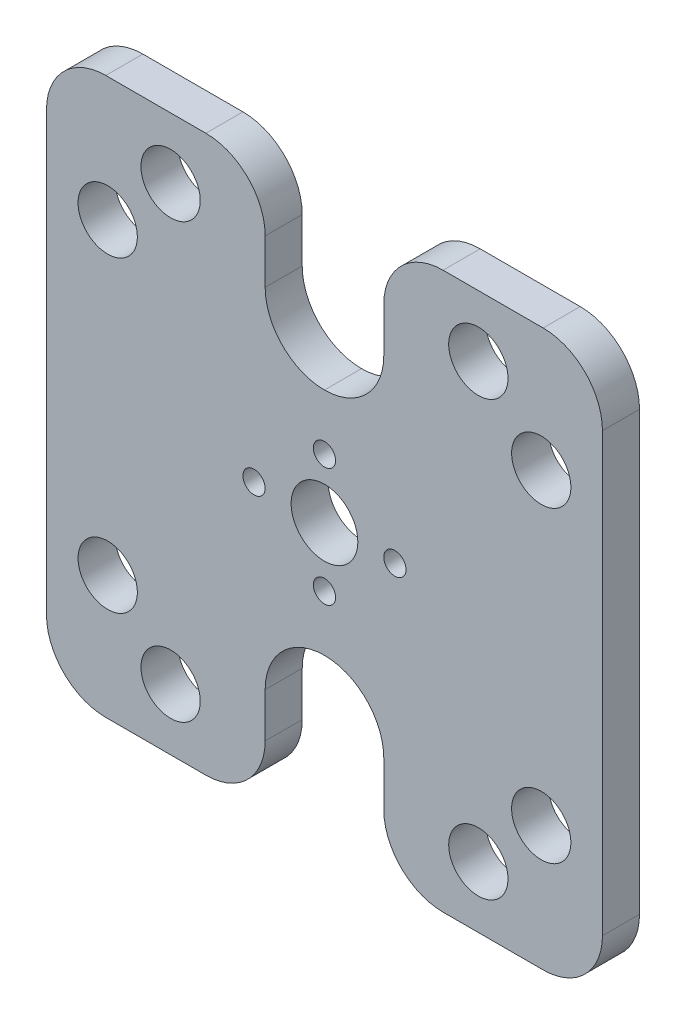
from build123d import *

# Parameters (mm, degrees)
SKETCH1_W           = 75
SKETCH1_H           = 75
SKETCH1_R           = 1.5
SKETCH1_R_2         = 4.5
SKETCH1_R_3         = 4
BOSS_EXTRUDE1_DEPTH = 5
SKETCH3_W           = 16
SKETCH3_H           = 22
CUT_EXTRUDE1_DEPTH  = 5
FILLET1_R           = 8


with BuildPart() as part:
    # Sketch1 → Boss-Extrude1 (new body)
    with BuildSketch(Plane(origin=(0, 0, 0), x_dir=(-1, 0, 0), z_dir=(0, 0, 1))):
        Rectangle(SKETCH1_W, SKETCH1_H)
        with Locations(Location((9.5, 0, 0), (0, 0, 180))):
            Circle(SKETCH1_R, mode=Mode.SUBTRACT)
        with Locations(Location((-9.5, 0, 0), (0, 0, 180))):
            Circle(SKETCH1_R, mode=Mode.SUBTRACT)
        with Locations(Location((0, -8, 0), (0, 0, 180))):
            Circle(SKETCH1_R, mode=Mode.SUBTRACT)
        with Locations(Location((0, 8, 0), (0, 0, 180))):
            Circle(SKETCH1_R, mode=Mode.SUBTRACT)
        with Locations(Location((0, 0, 0), (0, 0, 180))):
            Circle(SKETCH1_R_2, mode=Mode.SUBTRACT)
        with Locations(Location((20.757359313, 29.242640687, 0), (0, 0, 180))):
            Circle(SKETCH1_R_3, mode=Mode.SUBTRACT)
        with Locations((29.242640687, 20.757359313)):
            Circle(SKETCH1_R_3, mode=Mode.SUBTRACT)
        with Locations((-29.242640687, -20.757359313)):
            Circle(SKETCH1_R_3, mode=Mode.SUBTRACT)
        with Locations(Location((-20.757359313, -29.242640687, 0), (0, 0, 180))):
            Circle(SKETCH1_R_3, mode=Mode.SUBTRACT)
        with Locations((20.757359313, -29.242640687)):
            Circle(SKETCH1_R_3, mode=Mode.SUBTRACT)
        with Locations(Location((29.242640687, -20.757359313, 0), (0, 0, 180))):
            Circle(SKETCH1_R_3, mode=Mode.SUBTRACT)
        with Locations((-20.757359313, 29.242640687)):
            Circle(SKETCH1_R_3, mode=Mode.SUBTRACT)
        with Locations(Location((-29.242640687, 20.757359313, 0), (0, 0, 180))):
            Circle(SKETCH1_R_3, mode=Mode.SUBTRACT)
    extrude(amount=BOSS_EXTRUDE1_DEPTH)

    # Sketch3 → Cut-Extrude1 (cut)
    with BuildSketch(Plane.XY.offset(5)):
        with Locations((0, 26.5)):
            Rectangle(SKETCH3_W, SKETCH3_H)
        with Locations((0, -26.5)):
            Rectangle(SKETCH3_W, SKETCH3_H)
    extrude(amount=-CUT_EXTRUDE1_DEPTH, mode=Mode.SUBTRACT)

    # Fillet1
    fillet1_edges = [part.edges().sort_by_distance(p)[0] for p in [
        (-37.5, -37.5, 2.5),
        (-8, -37.5, 2.5),
        (8, -15.5, 2.5),
        (-8, -15.5, 2.5),
        (8, -37.5, 2.5),
        (37.5, -37.5, 2.5),
        (37.5, 37.5, 2.5),
        (8, 37.5, 2.5),
        (8, 15.5, 2.5),
        (-8, 15.5, 2.5),
        (-8, 37.5, 2.5),
        (-37.5, 37.5, 2.5),
    ]]
    fillet(fillet1_edges, radius=FILLET1_R - 0.0001)  # a hair under: the kernel refuses the full size


solid = part.part
